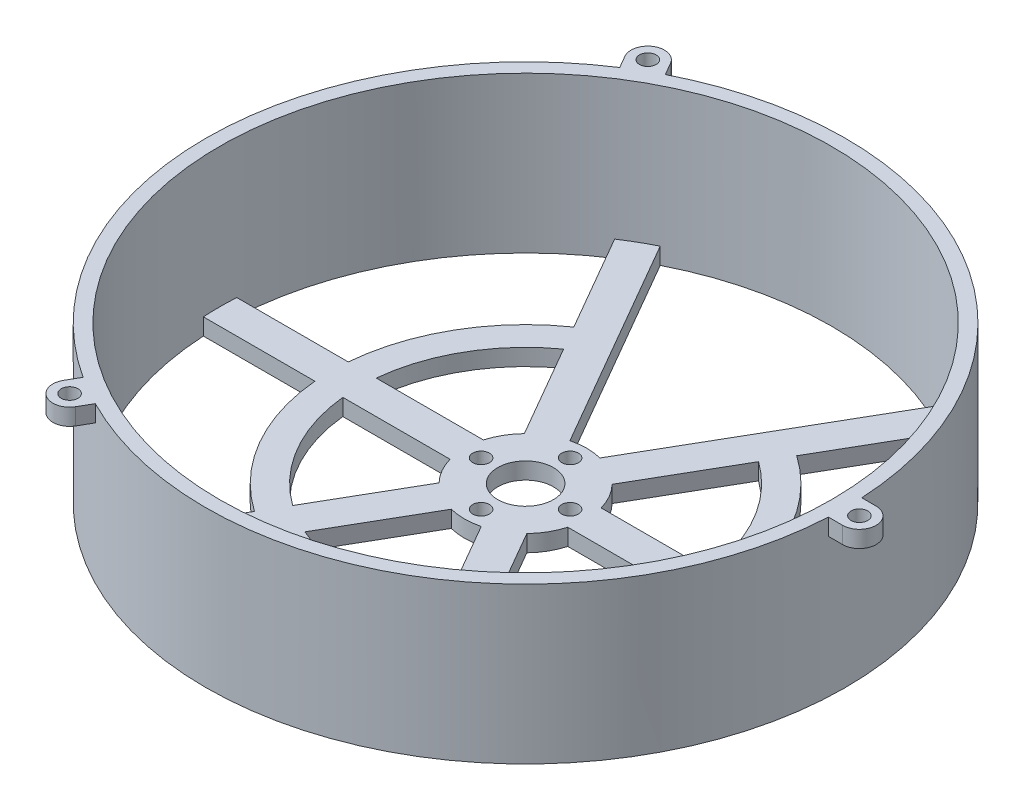
from build123d import *
from build123d.topology import SkipClean

# Parameters (mm, degrees)
SKETCH_1_R          = 1.5
SKETCH_1_R_2        = 5
EXTRUDE_1_DEPTH     = 3
SKETCH_2_R          = 57.5
SKETCH_2_R_2        = 55
EXTRUDE_2_DEPTH     = 25
EXTRUDE_START       = -3
SKETCH_3_R          = 1.5
EXTRUDE_3_DEPTH     = 3
CUT_EXTRUDE_START   = -30
SKETCH_4_R          = 69.475087651
SKETCH_4_R_2        = 57.5
CUT_EXTRUDE_1_DEPTH = 30
CUT_EXTRUDE_2_DEPTH = 10


with BuildPart() as part:
    # 草图1 → 凸台-拉伸1 (new body)
    with BuildSketch(Plane(origin=(0, 0, 0), x_dir=(1, 0, 0), z_dir=(0, 1, 0))):
        with BuildLine():
            Line((57.421685799, 3), (60, 3))
            ThreePointArc((60, 3), (63, 0), (60, -3))
            Line((60, -3), (57.421685799, -3))
            ThreePointArc((57.421685799, -3), (28.75, -49.796460718), (-26.112766688, -51.22863863))
            Line((-26.112766688, -51.22863863), (-27.401923789, -53.461524227))
            ThreePointArc((-27.401923789, -53.461524227), (-31.5, -54.559600438), (-32.598076211, -50.461524227))
            Line((-32.598076211, -50.461524227), (-31.308919111, -48.22863863))
            ThreePointArc((-31.308919111, -48.22863863), (-57.5, 0), (-31.308919111, 48.22863863))
            Line((-31.308919111, 48.22863863), (-32.598076211, 50.461524227))
            ThreePointArc((-32.598076211, 50.461524227), (-31.5, 54.559600438), (-27.401923789, 53.461524227))
            Line((-27.401923789, 53.461524227), (-26.112766688, 51.22863863))
            ThreePointArc((-26.112766688, 51.22863863), (28.75, 49.796460718), (57.421685799, 3))
        make_face()
        with Locations((0, 8)):
            Circle(SKETCH_1_R, mode=Mode.SUBTRACT)
        with Locations((8, 0)):
            Circle(SKETCH_1_R, mode=Mode.SUBTRACT)
        with Locations((0, -8)):
            Circle(SKETCH_1_R, mode=Mode.SUBTRACT)
        with Locations((-8, 0)):
            Circle(SKETCH_1_R, mode=Mode.SUBTRACT)
        Circle(SKETCH_1_R_2, mode=Mode.SUBTRACT)
        with Locations((60, 0)):
            Circle(SKETCH_1_R, mode=Mode.SUBTRACT)
        with Locations((-30, -51.961524227)):
            Circle(SKETCH_1_R, mode=Mode.SUBTRACT)
        with Locations((-30, 51.961524227)):
            Circle(SKETCH_1_R, mode=Mode.SUBTRACT)
        with BuildLine():
            Line((10.583005244, 3), (29.849623113, 3))
            ThreePointArc((29.849623113, 3), (25.980762114, 15), (17.522887768, 24.350531909))
            Line((17.522887768, 24.350531909), (7.889578833, 7.66515139))
            ThreePointArc((7.889578833, 7.66515139), (9.526279442, 5.5), (10.583005244, 3))
        make_face(mode=Mode.SUBTRACT)
        with BuildLine():
            Line((10.583005244, -3), (29.849623113, -3))
            ThreePointArc((29.849623113, -3), (25.980762114, -15), (17.522887768, -24.350531909))
            Line((17.522887768, -24.350531909), (7.889578833, -7.66515139))
            ThreePointArc((7.889578833, -7.66515139), (9.526279442, -5.5), (10.583005244, -3))
        make_face(mode=Mode.SUBTRACT)
        with BuildLine():
            Line((2.693426411, -10.66515139), (12.326735345, -27.350531909))
            ThreePointArc((12.326735345, -27.350531909), (0, -30), (-12.326735345, -27.350531909))
            Line((-12.326735345, -27.350531909), (-2.693426411, -10.66515139))
            ThreePointArc((-2.693426411, -10.66515139), (0, -11), (2.693426411, -10.66515139))
        make_face(mode=Mode.SUBTRACT)
        with BuildLine():
            Line((-14.837519563, 31.699337741), (-24.860984224, 49.060487802))
            ThreePointArc((-24.860984224, 49.060487802), (0, 55), (24.860984224, 49.060487802))
            Line((24.860984224, 49.060487802), (14.837519563, 31.699337741))
            ThreePointArc((14.837519563, 31.699337741), (0, 35), (-14.837519563, 31.699337741))
        make_face(mode=Mode.SUBTRACT)
        with BuildLine():
            Line((-7.889578833, -7.66515139), (-17.522887768, -24.350531909))
            ThreePointArc((-17.522887768, -24.350531909), (-25.980762114, -15), (-29.849623113, -3))
            Line((-29.849623113, -3), (-10.583005244, -3))
            ThreePointArc((-10.583005244, -3), (-9.526279442, -5.5), (-7.889578833, -7.66515139))
        make_face(mode=Mode.SUBTRACT)
        with BuildLine():
            Line((-10.583005244, 3), (-29.849623113, 3))
            ThreePointArc((-29.849623113, 3), (-25.980762114, 15), (-17.522887768, 24.350531909))
            Line((-17.522887768, 24.350531909), (-7.889578833, 7.66515139))
            ThreePointArc((-7.889578833, 7.66515139), (-9.526279442, 5.5), (-10.583005244, 3))
        make_face(mode=Mode.SUBTRACT)
        with BuildLine():
            Line((20.033671986, 28.699337741), (30.057136647, 46.060487802))
            ThreePointArc((30.057136647, 46.060487802), (47.631397208, 27.5), (54.918120871, 3))
            Line((54.918120871, 3), (34.871191548, 3))
            ThreePointArc((34.871191548, 3), (30.310889132, 17.5), (20.033671986, 28.699337741))
        make_face(mode=Mode.SUBTRACT)
        with BuildLine():
            Line((-20.033671986, 28.699337741), (-30.057136647, 46.060487802))
            ThreePointArc((-30.057136647, 46.060487802), (-47.631397208, 27.5), (-54.918120871, 3))
            Line((-54.918120871, 3), (-34.871191548, 3))
            ThreePointArc((-34.871191548, 3), (-30.310889132, 17.5), (-20.033671986, 28.699337741))
        make_face(mode=Mode.SUBTRACT)
        with BuildLine():
            Line((-2.693426411, 10.66515139), (-12.326735345, 27.350531909))
            ThreePointArc((-12.326735345, 27.350531909), (0, 30), (12.326735345, 27.350531909))
            Line((12.326735345, 27.350531909), (2.693426411, 10.66515139))
            ThreePointArc((2.693426411, 10.66515139), (0, 11), (-2.693426411, 10.66515139))
        make_face(mode=Mode.SUBTRACT)
        with BuildLine():
            Line((-34.871191548, -3), (-54.918120871, -3))
            ThreePointArc((-54.918120871, -3), (-47.631397208, -27.5), (-30.057136647, -46.060487802))
            Line((-30.057136647, -46.060487802), (-20.033671986, -28.699337741))
            ThreePointArc((-20.033671986, -28.699337741), (-30.310889132, -17.5), (-34.871191548, -3))
        make_face(mode=Mode.SUBTRACT)
        with BuildLine():
            Line((34.871191548, -3), (54.918120871, -3))
            ThreePointArc((54.918120871, -3), (47.631397208, -27.5), (30.057136647, -46.060487802))
            Line((30.057136647, -46.060487802), (20.033671986, -28.699337741))
            ThreePointArc((20.033671986, -28.699337741), (30.310889132, -17.5), (34.871191548, -3))
        make_face(mode=Mode.SUBTRACT)
        with BuildLine():
            Line((14.837519563, -31.699337741), (24.860984224, -49.060487802))
            ThreePointArc((24.860984224, -49.060487802), (0, -55), (-24.860984224, -49.060487802))
            Line((-24.860984224, -49.060487802), (-14.837519563, -31.699337741))
            ThreePointArc((-14.837519563, -31.699337741), (0, -35), (14.837519563, -31.699337741))
        make_face(mode=Mode.SUBTRACT)
    extrude(amount=EXTRUDE_1_DEPTH)

    # 草图2 → 凸台-拉伸2 (add)
    with SkipClean():  # the faces are left unmerged after this step: merging them gives an invalid solid
        with BuildSketch(Plane(origin=(0, 3, 0), x_dir=(1, 0, 0), z_dir=(0, 1, 0))):
            Circle(SKETCH_2_R)
            Circle(SKETCH_2_R_2, mode=Mode.SUBTRACT)
        extrude(amount=EXTRUDE_2_DEPTH)
    add(part.part.scale(1), mode=Mode.REPLACE)  # the faces are merged on a copy

    # 草图3 → 凸台-拉伸3 (add)
    # profile 1 of 3: a face of its own
    with SkipClean():  # the faces are left unmerged after this step: merging them gives an invalid solid
        with BuildSketch(Plane(origin=(0, 28, 0), x_dir=(1, 0, 0), z_dir=(0, 1, 0)).offset(EXTRUDE_START)):
            with BuildLine():
                Line((-32.598076211, 50.461524227), (-31.308919111, 48.22863863))
                ThreePointArc((-31.308919111, 48.22863863), (-28.75, 49.796460718), (-26.112766688, 51.22863863))
                Line((-26.112766688, 51.22863863), (-27.401923789, 53.461524227))
                ThreePointArc((-27.401923789, 53.461524227), (-31.5, 54.559600438), (-32.598076211, 50.461524227))
            make_face()
            with Locations((-30, 51.961524227)):
                Circle(SKETCH_3_R, mode=Mode.SUBTRACT)
        # profile 2 of 3: a face of its own
        with BuildSketch(Plane(origin=(0, 28, 0), x_dir=(1, 0, 0), z_dir=(0, 1, 0)).offset(EXTRUDE_START)):
            with BuildLine():
                Line((60, 3), (57.421685799, 3))
                ThreePointArc((57.421685799, 3), (57.5, 0), (57.421685799, -3))
                Line((57.421685799, -3), (60, -3))
                ThreePointArc((60, -3), (63, 0), (60, 3))
            make_face()
            with Locations((60, 0)):
                Circle(SKETCH_3_R, mode=Mode.SUBTRACT)
        # profile 3 of 3: a face of its own
        with BuildSketch(Plane(origin=(0, 28, 0), x_dir=(1, 0, 0), z_dir=(0, 1, 0)).offset(EXTRUDE_START)):
            with BuildLine():
                Line((-27.401923789, -53.461524227), (-26.112766688, -51.22863863))
                ThreePointArc((-26.112766688, -51.22863863), (-28.75, -49.796460718), (-31.308919111, -48.22863863))
                Line((-31.308919111, -48.22863863), (-32.598076211, -50.461524227))
                ThreePointArc((-32.598076211, -50.461524227), (-31.5, -54.559600438), (-27.401923789, -53.461524227))
            make_face()
            with Locations((-30, -51.961524227)):
                Circle(SKETCH_3_R, mode=Mode.SUBTRACT)
        extrude(amount=EXTRUDE_3_DEPTH)

    # 草图4 → 切除-拉伸1 (cut)
    with BuildSketch(Plane(origin=(0, 3, 0), x_dir=(1, 0, 0), z_dir=(0, 1, 0)).offset(CUT_EXTRUDE_START)):
        Circle(SKETCH_4_R)
        Circle(SKETCH_4_R_2, mode=Mode.SUBTRACT)
    extrude(amount=CUT_EXTRUDE_1_DEPTH, mode=Mode.SUBTRACT)

    # 草图5 → 切除-拉伸2 (cut)
    with BuildSketch(Plane.XZ):
        Polygon((-20.031496469, -40.695569636), (-10.067965636, -23.43822801), (9.224847601, -21.977904737), (20.031496469, -40.695569636), align=None)
    extrude(amount=-CUT_EXTRUDE_2_DEPTH, mode=Mode.SUBTRACT)


solid = part.part
